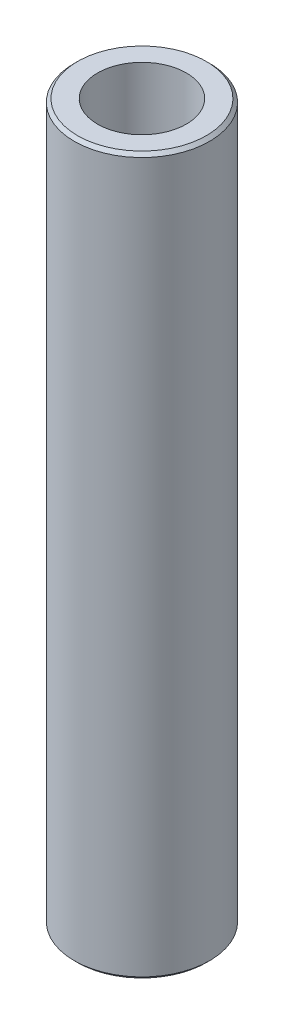
from build123d import *

# Parameters (mm, degrees)
SKETCH1_R           = 45
BOSS_EXTRUDE1_DEPTH = 476.418045287
SKETCH2_R           = 29.532538406
CUT_EXTRUDE1_DEPTH  = 481.649720561
CHAMFER1_SIZE       = 2.188196376


with BuildPart() as part:
    # Sketch1 → Boss-Extrude1 (new body)
    with BuildSketch(Plane(origin=(0, 0, 0), x_dir=(1, 0, 0), z_dir=(0, 1, 0))):
        Circle(SKETCH1_R)
    extrude(amount=BOSS_EXTRUDE1_DEPTH)

    # Sketch2 → Cut-Extrude1 (cut, through all)
    with BuildSketch(Plane(origin=(0, 0, 0), x_dir=(1, 0, 0), z_dir=(0, 1, 0))):
        Circle(SKETCH2_R)
    extrude(amount=CUT_EXTRUDE1_DEPTH, mode=Mode.SUBTRACT)

    # Chamfer1
    chamfer1_edges = [part.edges().sort_by_distance(p)[0] for p in [
        (-45, 476.418045287, 0),
        (-45, 0, 0),
    ]]
    chamfer(chamfer1_edges, length=CHAMFER1_SIZE)


solid = part.part
